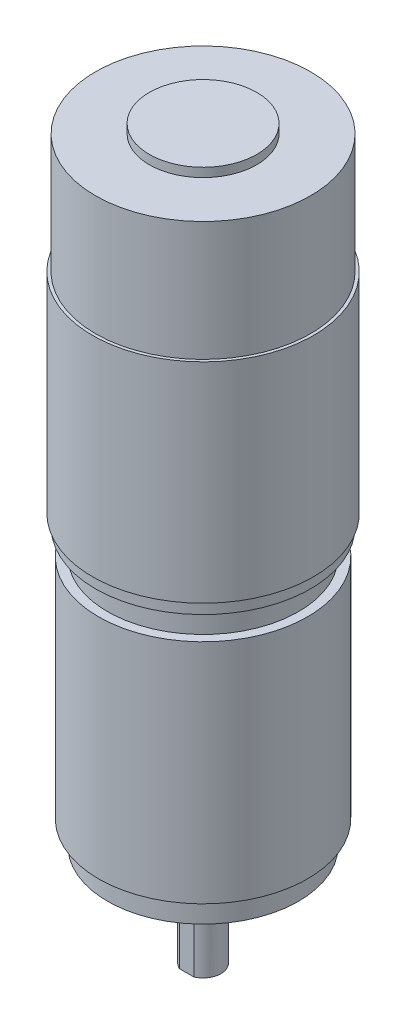
from build123d import *

# Parameters (mm, degrees)
SKETCH_4_OUTSIDE_W   = 65.512
SKETCH_4_OUTSIDE_H   = 65.512
SKETCH_4_OUTSIDE_W_2 = 6
SKETCH_4_OUTSIDE_H_2 = 5.5
CUT_EXTRUDE_2_DEPTH  = 12
SKETCH_5_R           = 1.5
CUT_EXTRUDE_3_DEPTH  = 5


with BuildPart() as part:
    # Эскиз1 → Повернуть1 (revolve)
    with BuildSketch(Plane.XY):
        Polygon((0, 0), (-9, 0), (-9, -1.5), (-18, -1.5), (-18, -21.5), (-18.5, -21.5), (-18.5, -56.5), (-18, -56.5), (-18, -58.5), (-16, -58.5), (-16, -62.8), (-17.5, -62.8), (-17.5, -100.8), (-16, -100.8), (-16, -104.8), (-10, -104.8), (-10, -106.8), (-3, -106.8), (-3, -121.8), (0, -121.8), align=None)
    revolve(axis=Axis((0, -180.909291234, 0), (0, 1, 0)))

    # Эскиз4 outside → Вырез-Вытянуть2 (cut)
    with BuildSketch(Plane.XZ.offset(121.8)):
        Rectangle(SKETCH_4_OUTSIDE_W, SKETCH_4_OUTSIDE_H)
        Rectangle(SKETCH_4_OUTSIDE_W_2, SKETCH_4_OUTSIDE_H_2, mode=Mode.SUBTRACT)
    extrude(amount=-CUT_EXTRUDE_2_DEPTH, mode=Mode.SUBTRACT)

    # Эскиз5 → Вырез-Вытянуть3 (cut)
    with BuildSketch(Plane.XZ.offset(104.8)):
        with Locations((-9, 9)):
            Circle(SKETCH_5_R)
        with Locations((9, 9)):
            Circle(SKETCH_5_R)
        with Locations((9, -9)):
            Circle(SKETCH_5_R)
        with Locations((-9, -9)):
            Circle(SKETCH_5_R)
    extrude(amount=-CUT_EXTRUDE_3_DEPTH, mode=Mode.SUBTRACT)


solid = part.part
